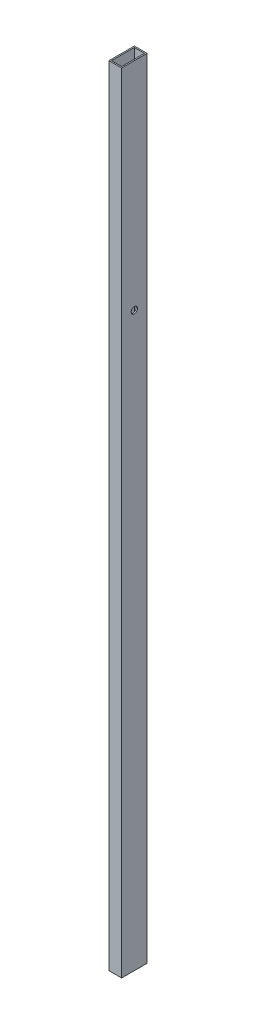
from build123d import *

# Parameters (mm, degrees)
SKETCH_1_W          = 20
SKETCH_1_H          = 40
SKETCH_1_W_2        = 16
SKETCH_1_H_2        = 36
EXTRUDE_1_DEPTH     = 1240
SKETCH_2_R          = 5
CUT_EXTRUDE_1_DEPTH = 1241.322538697
SKETCH_3_R          = 5
CUT_EXTRUDE_2_DEPTH = 10


with BuildPart() as part:
    # Эскиз1 → Вытянуть-Тонкостенный1 (new body)
    with BuildSketch(Plane(origin=(0, 0, 0), x_dir=(1, 0, 0), z_dir=(0, 1, 0))):
        Rectangle(SKETCH_1_W, SKETCH_1_H)
        Rectangle(SKETCH_1_W_2, SKETCH_1_H_2, mode=Mode.SUBTRACT)
    extrude(amount=EXTRUDE_1_DEPTH)

    # Эскиз2 → Вырез-Вытянуть1 (cut, through all)
    with BuildSketch(Plane(origin=(10, 0, 0), x_dir=(0, 0, -1), z_dir=(1, 0, 0))):
        with Locations((0, 900)):
            Circle(SKETCH_2_R)
    extrude(amount=-CUT_EXTRUDE_1_DEPTH, mode=Mode.SUBTRACT)

    # Эскиз3 → Вырез-Вытянуть2 (cut)
    with BuildSketch(Plane.ZY.offset(10)):
        with Locations((0, 720)):
            Circle(SKETCH_3_R)
        with Locations((0, 580)):
            Circle(SKETCH_3_R)
        with Locations((0, 440)):
            Circle(SKETCH_3_R)
    extrude(amount=-CUT_EXTRUDE_2_DEPTH, mode=Mode.SUBTRACT)


solid = part.part
